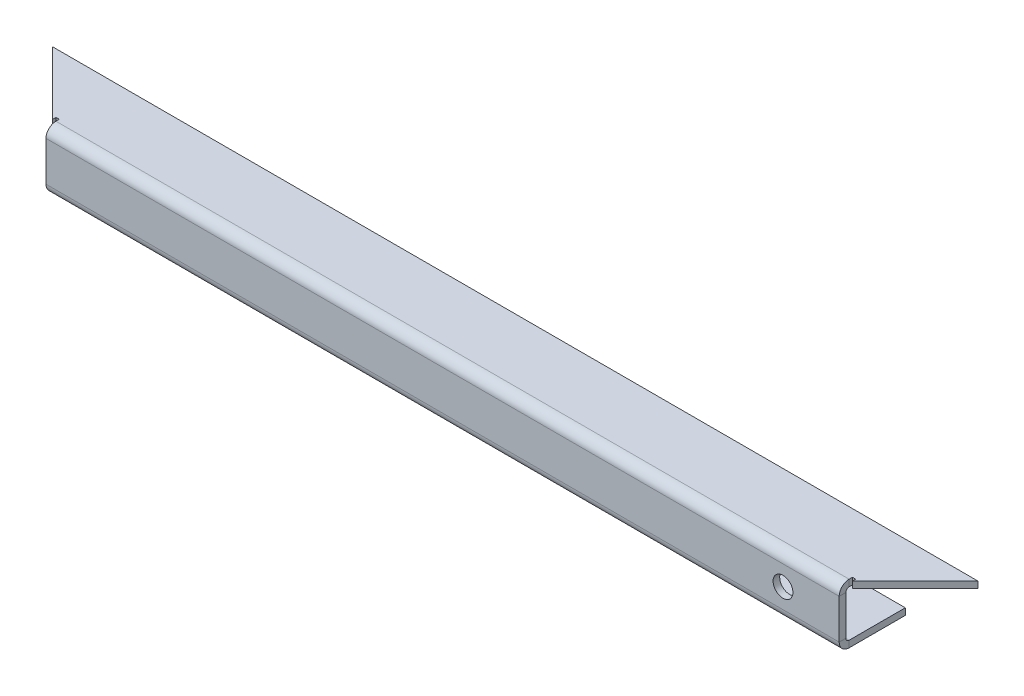
from build123d import *

# Parameters (mm, degrees)
BASE_FLANGE1_DEPTH            = 1
EDGE_FLANGE1_STRIP_W          = 5
EDGE_FLANGE1_STRIP_H          = 1
EDGE_FLANGE1_STRIP_CUT_DEPTH  = 120
EDGE_FLANGE1_RELIEF_W         = 5.5
EDGE_FLANGE1_RELIEF_H         = 0.5
EDGE_FLANGE1_RELIEF_CUT_DEPTH = 1
EDGE_FLANGE1_DEPTH            = 120
EDGE_FLANGE2_STRIP_W          = 5
EDGE_FLANGE2_STRIP_H          = 1
EDGE_FLANGE2_STRIP_CUT_DEPTH  = 120
EDGE_FLANGE2_DEPTH            = 120
SKETCH12_R                    = 1.5
CUT_EXTRUDE1_DEPTH            = 3
SKETCH13_R                    = 1.5
CUT_EXTRUDE2_DEPTH            = 3


# Sheet-metal steps are written as plain solids
with BuildPart() as part:
    # Sketch1 → Base-Flange1 (new body)
    with BuildSketch(Plane(origin=(0, 0, 0), x_dir=(1, 0, 0), z_dir=(0, 1, 0))):
        Polygon((-60, 0), (60, 0), (70, 10), (-70, 10), align=None)
    extrude(amount=-BASE_FLANGE1_DEPTH)

    # Edge-Flange1 strip (across the edge) → Edge-Flange1 strip cut (cut)
    with BuildSketch(Plane(origin=(60, -1, 0), x_dir=(0, 0, -1), z_dir=(-1, 0, 0))):
        with Locations((-2, -0.5)):
            Rectangle(EDGE_FLANGE1_STRIP_W, EDGE_FLANGE1_STRIP_H)
    extrude(amount=EDGE_FLANGE1_STRIP_CUT_DEPTH, mode=Mode.SUBTRACT)

    # Edge-Flange1 relief (on the sheet) → Edge-Flange1 relief cut (cut)
    with BuildSketch(Plane(origin=(60, -1, -0.5), x_dir=(0, 0, -1), z_dir=(0, -1, 0))):
        with Locations((-2.25, 0.25)):
            Rectangle(EDGE_FLANGE1_RELIEF_W, EDGE_FLANGE1_RELIEF_H)
        with Locations((-2.25, -120.25)):
            Rectangle(EDGE_FLANGE1_RELIEF_W, EDGE_FLANGE1_RELIEF_H)
    extrude(amount=-EDGE_FLANGE1_RELIEF_CUT_DEPTH, mode=Mode.SUBTRACT)

    # Edge-Flange1 section (across the edge) → Edge-Flange1 (add)
    with BuildSketch(Plane(origin=(60, -1, 0), x_dir=(0, 0, -1), z_dir=(-1, 0, 0))):
        with BuildLine():
            Line((-1, 0.5), (-1, 7))
            Line((-1, 7), (0, 7))
            Line((0, 7), (0, 0.5))
            ThreePointArc((0, 0.5), (0.146446609, 0.146446609), (0.5, 0))
            Line((0.5, 0), (0.5, -1))
            ThreePointArc((0.5, -1), (-0.560660172, -0.560660172), (-1, 0.5))
        make_face()
    extrude(amount=EDGE_FLANGE1_DEPTH)

    # Edge-Flange2 strip (across the edge) → Edge-Flange2 strip cut (cut)
    with BuildSketch(Plane(origin=(60, -8, 0), x_dir=(0, 1, 0), z_dir=(-1, 0, 0))):
        with Locations((-2, -0.5)):
            Rectangle(EDGE_FLANGE2_STRIP_W, EDGE_FLANGE2_STRIP_H)
    extrude(amount=EDGE_FLANGE2_STRIP_CUT_DEPTH, mode=Mode.SUBTRACT)

    # Edge-Flange2 section (across the edge) → Edge-Flange2 (add)
    with BuildSketch(Plane(origin=(60, -8, 0), x_dir=(0, 1, 0), z_dir=(-1, 0, 0))):
        with BuildLine():
            Line((-1, 0.5), (-1, 9))
            Line((-1, 9), (0, 9))
            Line((0, 9), (0, 0.5))
            ThreePointArc((0, 0.5), (0.146446609, 0.146446609), (0.5, 0))
            Line((0.5, 0), (0.5, -1))
            ThreePointArc((0.5, -1), (-0.560660172, -0.560660172), (-1, 0.5))
        make_face()
    extrude(amount=EDGE_FLANGE2_DEPTH)

    # Sketch12 → Cut-Extrude1 (cut)
    with BuildSketch(Plane.XZ.offset(9)):
        with Locations(Location((-50, -5, 0), (0, 0, 270))):
            Circle(SKETCH12_R)
        with Locations(Location((0, -5, 0), (0, 0, 270))):
            Circle(SKETCH12_R)
        with Locations(Location((50, -5, 0), (0, 0, 270))):
            Circle(SKETCH12_R)
    extrude(amount=-CUT_EXTRUDE1_DEPTH, mode=Mode.SUBTRACT)

    # Sketch13 → Cut-Extrude2 (cut)
    with BuildSketch(Plane(origin=(0, 0, 0), x_dir=(-1, 0, 0), z_dir=(0, 0, -1))):
        with Locations(Location((-51.5, -4.5, 0), (0, 0, 90))):
            Circle(SKETCH13_R)
    extrude(amount=-CUT_EXTRUDE2_DEPTH, mode=Mode.SUBTRACT)


solid = part.part
